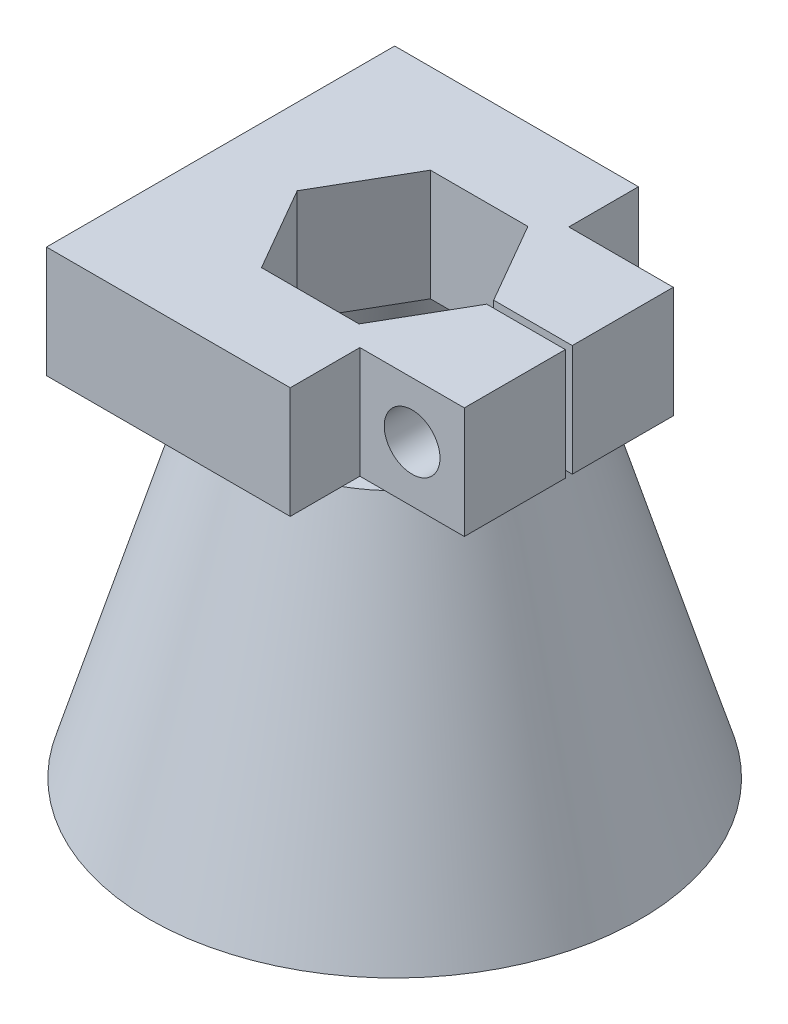
from build123d import *

# Parameters (mm, degrees)
SKETCH2_W                      = 50
SKETCH2_H                      = 50
BOSS_EXTRUDE1_DEPTH            = 16
SKETCH9_W                      = 15
SKETCH9_H                      = 16
CUT_EXTRUDE2_DEPTH             = 10
CBORE_FOR_M4_SHCS2_D           = 5
CBORE_FOR_M4_SHCS2_CBORE_D     = 8
CBORE_FOR_M4_SHCS2_CBORE_DEPTH = 8
SKETCH13_W                     = 15
SKETCH13_H                     = 16
CUT_EXTRUDE5_DEPTH             = 0.5


# Read off the part's stored shape, not the designer's step: Loft-Thin1
with BuildPart() as part:
    # Sketch2 → Boss-Extrude1 (new body)
    with BuildSketch(Plane(origin=(0, 0, 0), x_dir=(1, 0, 0), z_dir=(0, 1, 0))):
        Rectangle(SKETCH2_W, SKETCH2_H)
        Polygon((14, 0), (7, 12.124355653), (-7, 12.124355653), (-14, 0), (-7, -12.124355653), (7, -12.124355653), align=None, mode=Mode.SUBTRACT)
    extrude(amount=BOSS_EXTRUDE1_DEPTH)

    # Loft-Thin1 outline → Loft-Thin1 (revolve)
    with BuildSketch(Plane.XY):
        Polygon((30, -50), (35.220153254, -50), (20.220153254, 0), (15, 0), align=None)
    revolve(axis=Axis((0, 0, 0), (0, 1, 0)))

    # Sketch9 → Cut-Extrude2 (cut)
    with BuildSketch(Plane.XY.offset(25)):
        with Locations((17.5, 8)):
            Rectangle(SKETCH9_W, SKETCH9_H)
    cut_extrude2 = extrude(amount=-CUT_EXTRUDE2_DEPTH, mode=Mode.SUBTRACT)

    # Mirror2: Cut-Extrude2 across plane
    add(cut_extrude2.mirror(Plane.XY), mode=Mode.SUBTRACT)

    # CBORE for M4 SHCS2 (through all)
    with Locations(Plane(origin=(17.5, 8, 15), x_dir=(1, 0, 0), z_dir=(0, 0, 1))):
        with Locations((0, 0)):
            cbore_for_m4_shcs2 = CounterBoreHole(CBORE_FOR_M4_SHCS2_D / 2, CBORE_FOR_M4_SHCS2_CBORE_D / 2, CBORE_FOR_M4_SHCS2_CBORE_DEPTH)

    # Mirror3: CBORE for M4 SHCS2 across plane
    add(cbore_for_m4_shcs2.mirror(Plane.XY), mode=Mode.SUBTRACT)

    # Sketch13 → Cut-Extrude5 (cut, symmetric)
    with BuildSketch(Plane.XY):
        with Locations((17.5, 8)):
            Rectangle(SKETCH13_W, SKETCH13_H)
    extrude(amount=CUT_EXTRUDE5_DEPTH, both=True, mode=Mode.SUBTRACT)


solid = part.part
